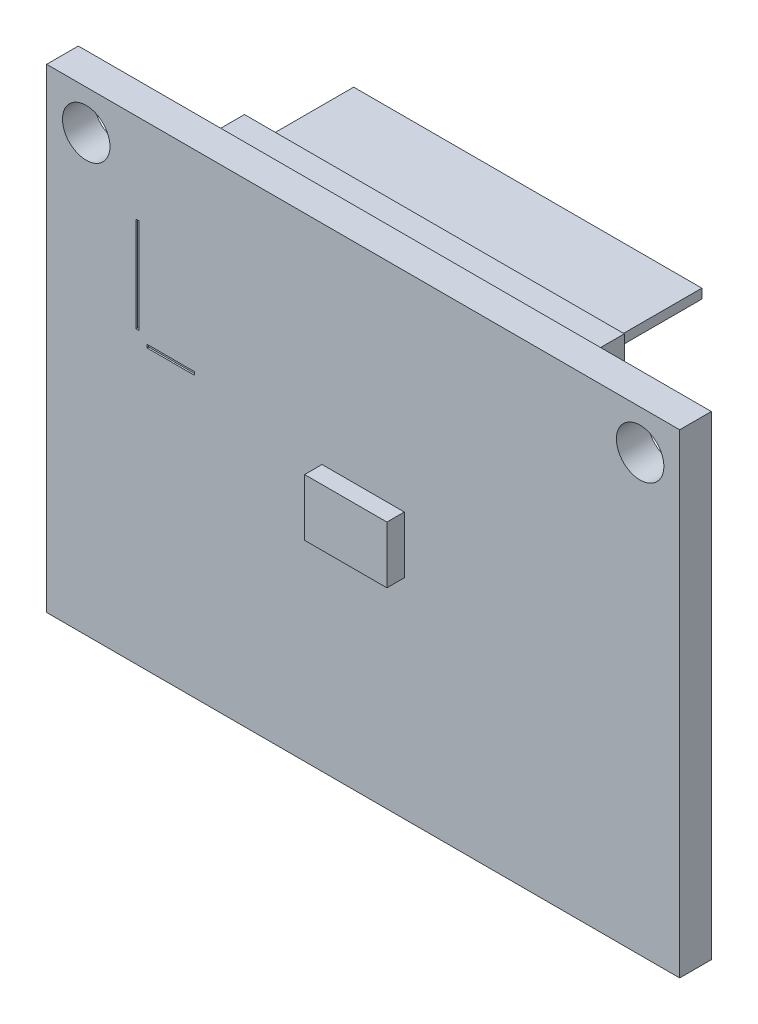
from build123d import *

# Parameters (mm, degrees)
SKETCH1_W           = 40
SKETCH1_H           = 30
BOSS_EXTRUDE1_DEPTH = 1
SKETCH2_W           = 24
SKETCH2_H           = 2.5
BOSS_EXTRUDE2_DEPTH = 2.5
SKETCH3_W           = 22
SKETCH3_H           = 0.6
BOSS_EXTRUDE3_DEPTH = 6.1
CHAMFER1_SIZE       = 0.2
SKETCH4_W           = 5.2
SKETCH4_H           = 3.6
BOSS_EXTRUDE4_DEPTH = 1.1
SKETCH5_W           = 0.2
SKETCH5_H           = 6
SKETCH5_W_2         = 3
SKETCH5_H_2         = 0.2
CUT_EXTRUDE1_DEPTH  = 0.1
SKETCH6_R           = 1.5
CUT_EXTRUDE2_DEPTH  = 28.154373497


with BuildPart() as part:
    # Sketch1 → Boss-Extrude1 (new, symmetric)
    with BuildSketch(Plane.XY):
        Rectangle(SKETCH1_W, SKETCH1_H)
    extrude(amount=BOSS_EXTRUDE1_DEPTH, both=True)

    # Sketch2 → Boss-Extrude2 (add)
    with BuildSketch(Plane(origin=(0, 0, -1), x_dir=(-1, 0, 0), z_dir=(0, 0, -1))):
        with Locations((0, -12.75)):
            Rectangle(SKETCH2_W, SKETCH2_H)
        with Locations((0, 12.75)):
            Rectangle(SKETCH2_W, SKETCH2_H)
    extrude(amount=BOSS_EXTRUDE2_DEPTH)

    # Sketch3 → Boss-Extrude3 (add)
    with BuildSketch(Plane(origin=(0, 0, -3.5), x_dir=(-1, 0, 0), z_dir=(0, 0, -1))):
        with Locations((0, 12.75)):
            Rectangle(SKETCH3_W, SKETCH3_H)
        with Locations((0, -12.75)):
            Rectangle(SKETCH3_W, SKETCH3_H)
    extrude(amount=BOSS_EXTRUDE3_DEPTH)

    # Chamfer1
    chamfer1_edges = [part.edges().sort_by_distance(p)[0] for p in [
        (11, -12.75, -9.6),
        (0, -12.45, -9.6),
        (-11, -12.75, -9.6),
        (0, -13.05, -9.6),
        (0, 13.05, -9.6),
        (-11, 12.75, -9.6),
        (0, 12.45, -9.6),
        (11, 12.75, -9.6),
    ]]
    chamfer(chamfer1_edges, length=CHAMFER1_SIZE)

    # Sketch4 → Boss-Extrude4 (add)
    with BuildSketch(Plane.XY.offset(1)):
        Rectangle(SKETCH4_W, SKETCH4_H)
    extrude(amount=BOSS_EXTRUDE4_DEPTH)

    # Sketch5 → Cut-Extrude1 (cut)
    with BuildSketch(Plane.XY.offset(1)):
        with Locations((-14.25, 6.35)):
            Rectangle(SKETCH5_W, SKETCH5_H)
        with Locations((-12.15, 2.75)):
            Rectangle(SKETCH5_W_2, SKETCH5_H_2)
    extrude(amount=-CUT_EXTRUDE1_DEPTH, mode=Mode.SUBTRACT)

    # Sketch6 → Cut-Extrude2 (cut, through all)
    with BuildSketch(Plane.XY.offset(1)):
        with Locations((-17.5, 12.5)):
            Circle(SKETCH6_R)
        with Locations((17.5, 12.5)):
            Circle(SKETCH6_R)
    extrude(amount=-CUT_EXTRUDE2_DEPTH, mode=Mode.SUBTRACT)


solid = part.part
